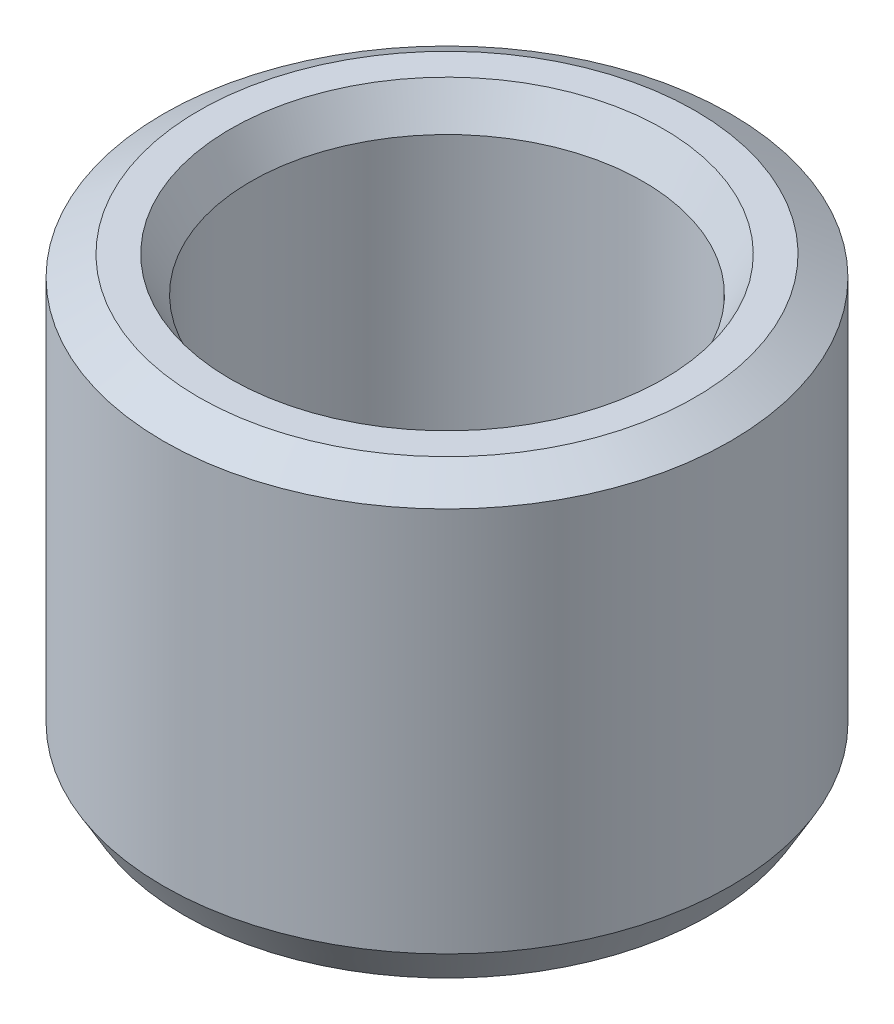
from build123d import *
from OCP.BRepFilletAPI import BRepFilletAPI_MakeChamfer

# Parameters (mm, degrees)
SKETCH1_R           = 50
BOSS_EXTRUDE1_DEPTH = 77.768592619
SKETCH2_R           = 34.601941725
CUT_EXTRUDE1_DEPTH  = 106.109247918
CHAMFER1_SIZE       = 3.591653229
CHAMFER1_SIZE2      = 6.220925875


with BuildPart() as part:
    # Sketch1 → Boss-Extrude1 (new body)
    with BuildSketch(Plane(origin=(0, 0, 0), x_dir=(1, 0, 0), z_dir=(0, 1, 0))):
        Circle(SKETCH1_R)
    extrude(amount=BOSS_EXTRUDE1_DEPTH)

    # Sketch2 → Cut-Extrude1 (cut, through all)
    with BuildSketch(Plane(origin=(0, 0, 0), x_dir=(1, 0, 0), z_dir=(0, 1, 0))):
        Circle(SKETCH2_R)
    extrude(amount=CUT_EXTRUDE1_DEPTH, mode=Mode.SUBTRACT)

    # Chamfer1: one chamfer whose edges measure the first distance from different faces: ONE call of the kernel's chamfer builder (chamfer() names one face for all edges)
    chamfer1_edges_1 = [part.edges().sort_by_distance(p)[0] for p in [
        (-34.601941725, 77.768592619, 0),
    ]]
    chamfer1_side_1 = [part.faces().sort_by_distance(p)[0] for p in [
        (-48.585786438, 77.768592619, 0),
    ]]
    chamfer1_edges_2 = [part.edges().sort_by_distance(p)[0] for p in [
        (-34.601941725, 0, 0),
    ]]
    chamfer1_side_2 = [part.faces().sort_by_distance(p)[0] for p in [
        (-34.601941725, 38.884296309, 0),
    ]]
    chamfer1_edges_3 = [part.edges().sort_by_distance(p)[0] for p in [
        (-50, 0, 0),
    ]]
    chamfer1_side_3 = [part.faces().sort_by_distance(p)[0] for p in [
        (-48.585786438, 0, 0),
    ]]
    chamfer1_edges_4 = [part.edges().sort_by_distance(p)[0] for p in [
        (-50, 77.768592619, 0),
    ]]
    chamfer1_side_4 = [part.faces().sort_by_distance(p)[0] for p in [
        (-50, 38.884296309, 0),
    ]]
    chamfer1 = BRepFilletAPI_MakeChamfer(part.part.solid().wrapped)
    for e in chamfer1_edges_1:
        chamfer1.Add(CHAMFER1_SIZE, CHAMFER1_SIZE2, e.wrapped, chamfer1_side_1[0].wrapped)  # the first distance lies on this face
    for e in chamfer1_edges_2:
        chamfer1.Add(CHAMFER1_SIZE, CHAMFER1_SIZE2, e.wrapped, chamfer1_side_2[0].wrapped)  # the first distance lies on this face
    for e in chamfer1_edges_3:
        chamfer1.Add(CHAMFER1_SIZE, CHAMFER1_SIZE2, e.wrapped, chamfer1_side_3[0].wrapped)  # the first distance lies on this face
    for e in chamfer1_edges_4:
        chamfer1.Add(CHAMFER1_SIZE, CHAMFER1_SIZE2, e.wrapped, chamfer1_side_4[0].wrapped)  # the first distance lies on this face
    add(Compound.cast(chamfer1.Shape()), mode=Mode.REPLACE)


solid = part.part
